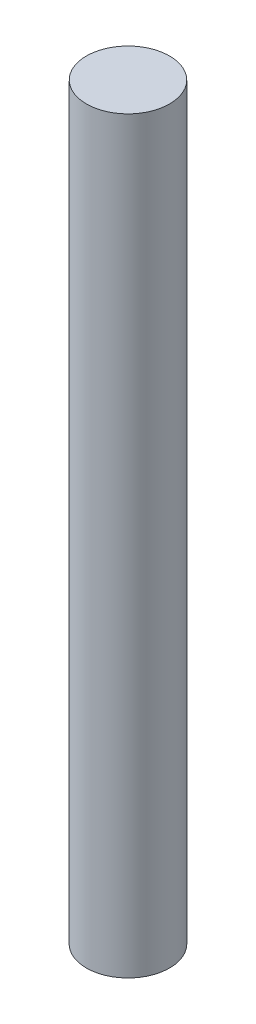
from build123d import *

# Parameters (mm, degrees)
SKETCH1_R           = 2
BOSS_EXTRUDE1_DEPTH = 36


with BuildPart() as part:
    # Sketch1 → Boss-Extrude1 (new body)
    with BuildSketch(Plane(origin=(0, 0, 0), x_dir=(1, 0, 0), z_dir=(0, 1, 0))):
        Circle(SKETCH1_R)
    extrude(amount=BOSS_EXTRUDE1_DEPTH)


solid = part.part
